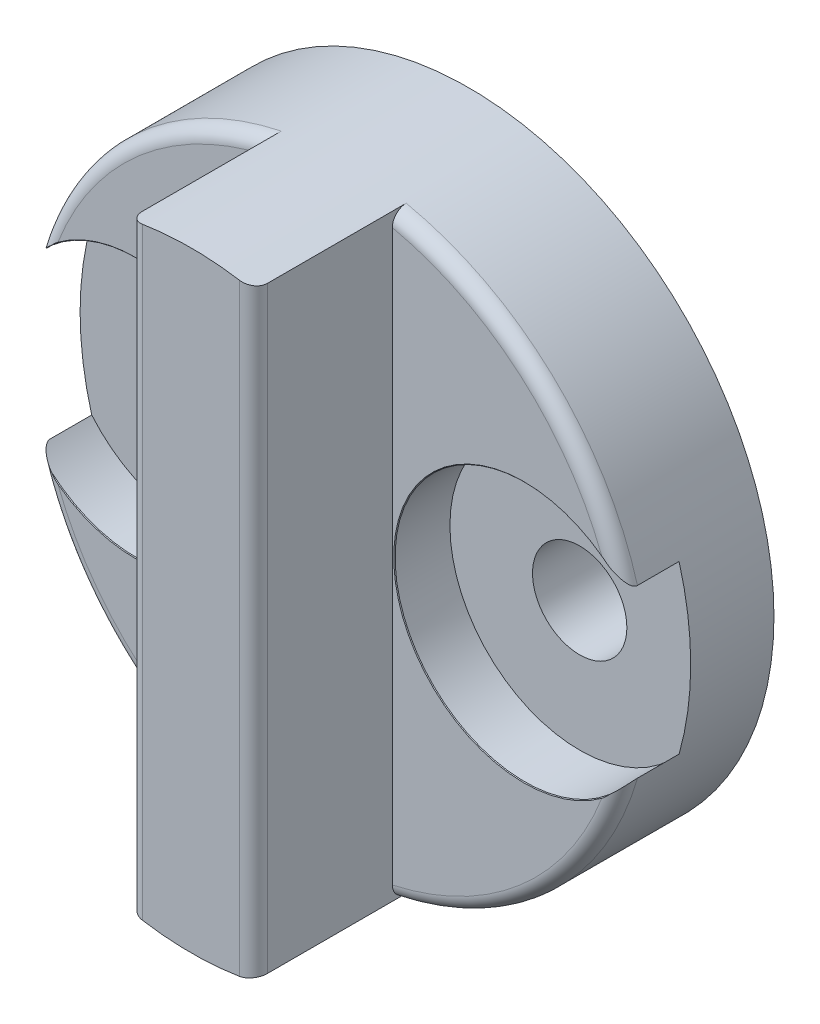
from build123d import *

# Parameters (mm, degrees)
ESQUISSE1_R                                = 11
BOSS_EXTRU_1_DEPTH                         = 5
BOSS_EXTRU_2_DEPTH                         = 5
CONG_1_R                                   = 0.5
CONG_2_R                                   = 0.5
CHAMBRAGE_POUR_VIS_T_TE_HEXAGONALE_2_COUNT = 2
CHAMBRAGE_POUR_VIS_T_TE_HEXAGONALE_2_PITCH = 14


with BuildPart() as part:
    # Esquisse1 → Boss.-Extru.1 (new body)
    with BuildSketch(Plane.XY):
        Circle(ESQUISSE1_R)
    extrude(amount=BOSS_EXTRU_1_DEPTH)

    # Esquisse2 → Boss.-Extru.2 (add)
    with BuildSketch(Plane.XY.offset(5)):
        with BuildLine():
            Line((-2.25, 10.767427734), (-2.25, -10.767427734))
            ThreePointArc((-2.25, -10.767427734), (0, -11), (2.25, -10.767427734))
            Line((2.25, -10.767427734), (2.25, 10.767427734))
            ThreePointArc((2.25, 10.767427734), (0, 11), (-2.25, 10.767427734))
        make_face()
    extrude(amount=BOSS_EXTRU_2_DEPTH)

    # Congé1
    # the kernel refuses this fillet: 0.5 mm, written as the material it takes off along each edge
    with BuildSketch(Plane(origin=(0, 0, 5), x_dir=(1, 0, 0), z_dir=(0, -1, 0))) as cong_1_piece_1_section:
        with BuildLine():
            CenterArc((11 - CONG_1_R, -CONG_1_R), CONG_1_R, 0, 90)
            Line((11 - CONG_1_R, 0), (11, 0))
            Line((11, 0), (11, -CONG_1_R))
        make_face()
    cong_1_piece_1 = revolve(axis=Axis((0, 0, 5), (0, 0, 1)), revolution_arc=84.709966663, mode=Mode.PRIVATE)
    cong_1_piece_1 = split(cong_1_piece_1, bisect_by=Plane(origin=(2.25, 6.849238197, 4.860494097), z_dir=(1, 0, 0)), keep=Keep.TOP, mode=Mode.PRIVATE)
    add(cong_1_piece_1, mode=Mode.SUBTRACT)
    with BuildSketch(Plane(origin=(0, 0, 5), x_dir=(-0.09209435598591774, 0.9957502847579502, 0), z_dir=(0.9957502847579502, 0.09209435598591774, 0))) as cong_1_piece_2_section:
        with BuildLine():
            CenterArc((11 - CONG_1_R, -CONG_1_R), CONG_1_R, 0, 90)
            Line((11 - CONG_1_R, 0), (11, 0))
            Line((11, 0), (11, -CONG_1_R))
        make_face()
    cong_1_piece_2 = revolve(axis=Axis((0, 0, 5), (0, 0, 1)), revolution_arc=169.431789296, mode=Mode.PRIVATE)
    cong_1_piece_2 = split(cong_1_piece_2, bisect_by=Plane(origin=(-2.25, 0, 4.86229808), z_dir=(-1, 0, 0)), keep=Keep.TOP, mode=Mode.PRIVATE)
    add(cong_1_piece_2, mode=Mode.SUBTRACT)
    with BuildSketch(Plane(origin=(0, 0, 5), x_dir=(0.09219737865829941, -0.9957407510836032, 0), z_dir=(-0.9957407510836032, -0.09219737865829941, 0))) as cong_1_piece_3_section:
        with BuildLine():
            CenterArc((11 - CONG_1_R, -CONG_1_R), CONG_1_R, 0, 90)
            Line((11 - CONG_1_R, 0), (11, 0))
            Line((11, 0), (11, -CONG_1_R))
        make_face()
    cong_1_piece_3 = revolve(axis=Axis((0, 0, 5), (0, 0, 1)), revolution_arc=84.709966663, mode=Mode.PRIVATE)
    cong_1_piece_3 = split(cong_1_piece_3, bisect_by=Plane(origin=(2.25, -6.849238209, 4.860494116), z_dir=(1, 0, 0)), keep=Keep.TOP, mode=Mode.PRIVATE)
    add(cong_1_piece_3, mode=Mode.SUBTRACT)

    # Congé2
    cong_2_edges = [part.edges().sort_by_distance(p)[0] for p in [
        (-2.25, 0, 10),
        (2.25, 0, 10),
    ]]
    fillet(cong_2_edges, radius=CONG_2_R)

    # Esquisse4 → Chambrage pour vis à tête hexagonale M31 (revolve, cut)
    with BuildSketch(Plane(origin=(-7, 0, 5), x_dir=(0, -1, 0), z_dir=(1, 0, 0))):
        Polygon((0, 0), (0, 5), (1.7, 5), (1.7, 2), (4.6755, 2), (4.6755, 0.025), (4.7005, 0), align=None)
    chambrage_pour_vis_t_te_hexagonale_m31 = revolve(axis=Axis((-7, 0, 11.35), (0, 0, -1)), mode=Mode.SUBTRACT)

    # Chambrage pour vis _ t_te hexagonale 2: Chambrage pour vis à tête hexagonale M31 ×2
    with Locations(*[(i * CHAMBRAGE_POUR_VIS_T_TE_HEXAGONALE_2_PITCH, 0, 0) for i in range(1, CHAMBRAGE_POUR_VIS_T_TE_HEXAGONALE_2_COUNT)]):
        add(chambrage_pour_vis_t_te_hexagonale_m31, mode=Mode.SUBTRACT)


solid = part.part
